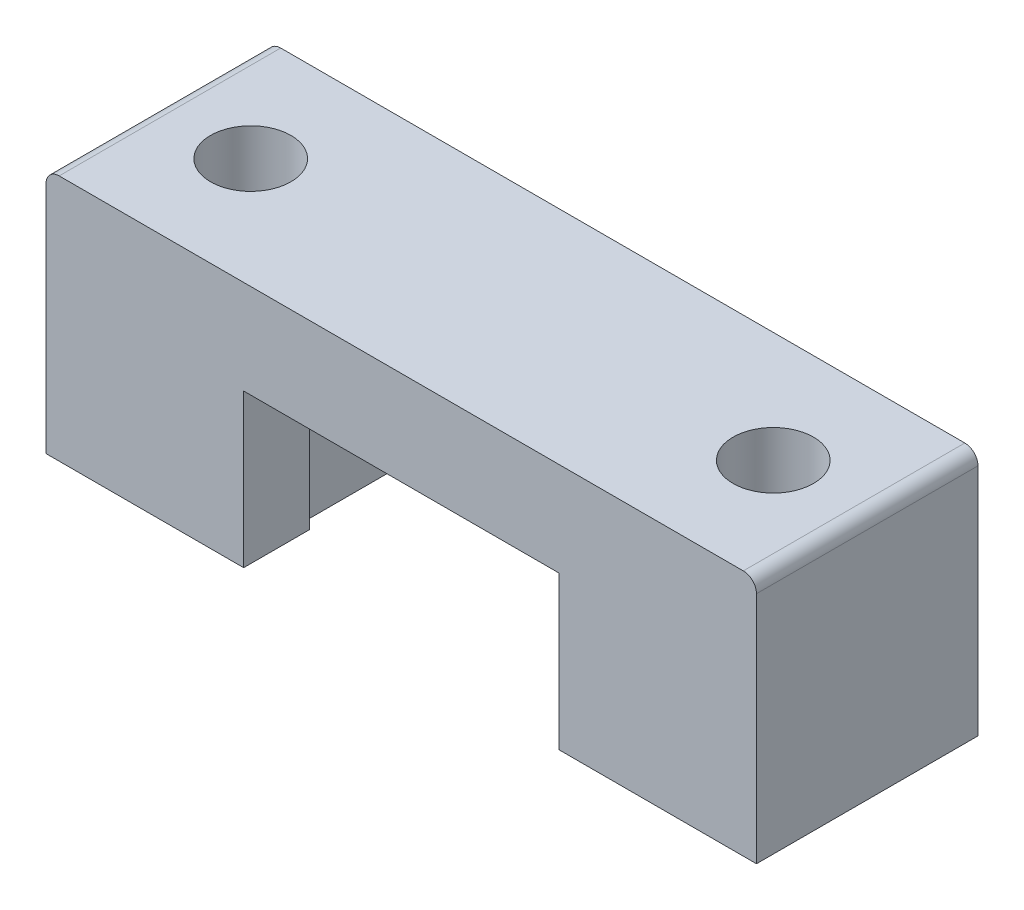
from build123d import *

# Parameters (mm, degrees)
SKETCH1_W           = 27.39
SKETCH1_H           = 8.54
SKETCH1_R           = 1.55
BOSS_EXTRUDE1_DEPTH = 9.525
CUT_EXTRUDE1_DEPTH  = 5.9
FILLET1_R           = 0.508


with BuildPart() as part:
    # Sketch1 → Boss-Extrude1 (new body)
    with BuildSketch(Plane(origin=(0, 0, 0), x_dir=(1, 0, 0), z_dir=(0, 1, 0))):
        with Locations((6.45, -4.27)):
            Rectangle(SKETCH1_W, SKETCH1_H)
        with Locations((16.5225, -4.27)):
            Circle(SKETCH1_R, mode=Mode.SUBTRACT)
        with Locations((-3.6225, -4.27)):
            Circle(SKETCH1_R, mode=Mode.SUBTRACT)
    extrude(amount=BOSS_EXTRUDE1_DEPTH)

    # Sketch1<4> → Cut-Extrude1 (cut)
    with BuildSketch(Plane(origin=(0, 0, 0), x_dir=(1, 0, 0), z_dir=(0, 1, 0))):
        Polygon((12.9, 0), (0, 0), (0, -6), (0.375, -6), (0.375, -8.54), (12.525, -8.54), (12.525, -6), (12.9, -6), align=None)
    extrude(amount=CUT_EXTRUDE1_DEPTH, mode=Mode.SUBTRACT)

    # Fillet1
    fillet1_edges = [part.edges().sort_by_distance(p)[0] for p in [
        (-7.245, 9.525, 4.27),
        (20.145, 9.525, 4.27),
    ]]
    fillet(fillet1_edges, radius=FILLET1_R)


solid = part.part
